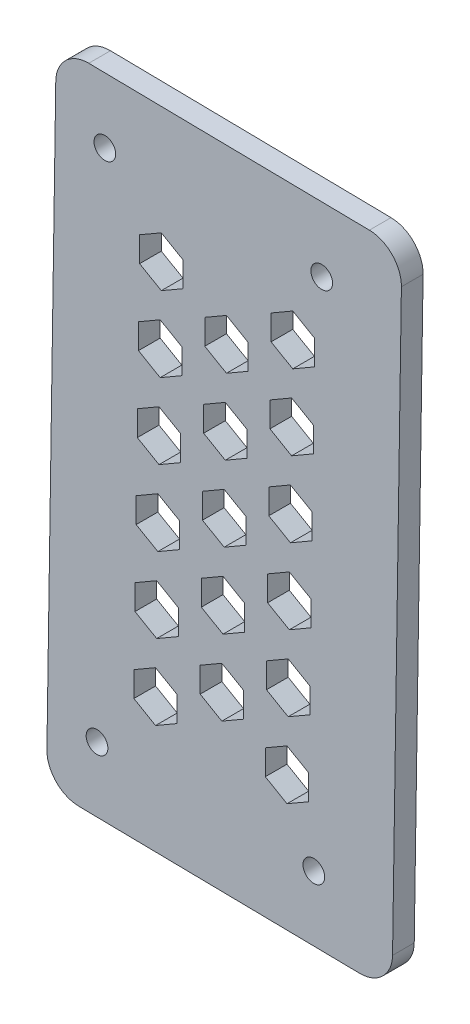
from build123d import *

# Parameters (mm, degrees)
SKETCH_1_R          = 1
EXTRUDE_1_DEPTH     = 2
FILLET_1_R          = 3
CUT_EXTRUDE_1_DEPTH = 10
OTHER_1_DEPTH       = 2


# Read off the part's stored shape, not the designer's step: 填充阵列1
with BuildPart() as part:
    # 草图1 → 凸台-拉伸1 (new body)
    with BuildSketch(Plane.XY):
        Polygon((-246.460434143, 16.421045692), (-247.367512812, -43.383226063), (-279.241752663, -42.899690556), (-278.334515728, 16.904578798), align=None)
        with Locations((-273.852745372, 10.835899523)):
            Circle(SKETCH_1_R, mode=Mode.SUBTRACT)
        with Locations((-253.855045493, 10.532585287)):
            Circle(SKETCH_1_R, mode=Mode.SUBTRACT)
        with Locations((-254.580263739, -37.273170465)):
            Circle(SKETCH_1_R, mode=Mode.SUBTRACT)
        with Locations((-274.577962013, -36.969750385)):
            Circle(SKETCH_1_R, mode=Mode.SUBTRACT)
    extrude(amount=EXTRUDE_1_DEPTH)

    # 圆角1
    fillet_1_edges = [part.edges().sort_by_distance(p)[0] for p in [
        (-246.460434143, 16.421045692, 1),
        (-247.367512812, -43.383226063, 1),
        (-279.241752663, -42.899690556, 1),
        (-278.334515728, 16.904578798, 1),
    ]]
    fillet(fillet_1_edges, radius=FILLET_1_R)

    # 草图2 → 切除-拉伸1 (cut)
    with BuildSketch(Plane.XY.offset(2)):
        Polygon((-260.851053776, -13.269658771), (-264.851053776, -13.208979355), (-264.851053776, -14.394019601), (-262.851053776, -15.54872014), (-260.851053776, -14.394019601), align=None)
        Polygon((-264.851053776, -12.084618525), (-264.851053776, -13.208979355), (-260.851053776, -13.269658771), (-260.851053776, -12.084618525), (-262.851053776, -10.929917986), align=None)
    extrude(amount=-CUT_EXTRUDE_1_DEPTH, mode=Mode.SUBTRACT)

    # 填充阵列1 outline → 填充阵列1 (cut)
    with BuildSketch(Plane.XY):
        Polygon((-258.52417318, 5.321431628), (-258.52417318, 3.012030551), (-256.52417318, 1.857330013), (-254.52417318, 3.012030551), (-254.52417318, 5.321431628), (-256.52417318, 6.476132167), align=None)
        Polygon((-271.07177439, -22.49147372), (-271.07177439, -24.800874796), (-269.07177439, -25.955575335), (-267.07177439, -24.800874796), (-267.07177439, -22.49147372), (-269.07177439, -21.336773181), align=None)
        Polygon((-258.94881311, -22.675348203), (-258.94881311, -24.98474928), (-256.94881311, -26.139449818), (-254.94881311, -24.98474928), (-254.94881311, -22.675348203), (-256.94881311, -21.520647665), align=None)
        Polygon((-264.957213759, -19.083813483), (-264.957213759, -21.393214559), (-262.957213759, -22.547915098), (-260.957213759, -21.393214559), (-260.957213759, -19.083813483), (-262.957213759, -17.929112944), align=None)
        Polygon((-270.965614407, -15.492278762), (-270.965614407, -17.801679839), (-268.965614407, -18.956380377), (-266.965614407, -17.801679839), (-266.965614407, -15.492278762), (-268.965614407, -14.337578223), align=None)
        Polygon((-265.063373741, -26.08300844), (-265.063373741, -28.392409517), (-263.063373741, -29.547110056), (-261.063373741, -28.392409517), (-261.063373741, -26.08300844), (-263.063373741, -24.928307902), align=None)
        Polygon((-259.054973093, -29.674543161), (-259.054973093, -31.983944238), (-257.054973093, -33.138644776), (-255.054973093, -31.983944238), (-255.054973093, -29.674543161), (-257.054973093, -28.519842623), align=None)
        Polygon((-271.177934372, -29.490668678), (-271.177934372, -31.800069754), (-269.177934372, -32.954770293), (-267.177934372, -31.800069754), (-267.177934372, -29.490668678), (-269.177934372, -28.335968139), align=None)
        Polygon((-270.753294442, -1.493888846), (-270.753294442, -3.803289923), (-268.753294442, -4.957990461), (-266.753294442, -3.803289923), (-266.753294442, -1.493888846), (-268.753294442, -0.339188308), align=None)
        Polygon((-258.630333163, -1.67776333), (-258.630333163, -3.987164406), (-256.630333163, -5.141864945), (-254.630333163, -3.987164406), (-254.630333163, -1.67776333), (-256.630333163, -0.523062791), align=None)
        Polygon((-264.638733811, 1.913771391), (-264.638733811, -0.395629686), (-262.638733811, -1.550330224), (-260.638733811, -0.395629686), (-260.638733811, 1.913771391), (-262.638733811, 3.068471929), align=None)
        Polygon((-270.647134459, 5.505306112), (-270.647134459, 3.195905035), (-268.647134459, 2.041204497), (-266.647134459, 3.195905035), (-266.647134459, 5.505306112), (-268.647134459, 6.66000665), align=None)
        Polygon((-258.842653128, -15.676153245), (-258.842653128, -17.985554322), (-256.842653128, -19.14025486), (-254.842653128, -17.985554322), (-254.842653128, -15.676153245), (-256.842653128, -14.521452707), align=None)
        Polygon((-270.859454424, -8.493083804), (-270.859454424, -10.802484881), (-268.859454424, -11.957185419), (-266.859454424, -10.802484881), (-266.859454424, -8.493083804), (-268.859454424, -7.338383266), align=None)
        Polygon((-258.736493145, -8.676958287), (-258.736493145, -10.986359364), (-256.736493145, -12.141059903), (-254.736493145, -10.986359364), (-254.736493145, -8.676958287), (-256.736493145, -7.522257749), align=None)
        Polygon((-264.744893794, -5.085423567), (-264.744893794, -7.394824644), (-262.744893794, -8.549525182), (-260.744893794, -7.394824644), (-260.744893794, -5.085423567), (-262.744893794, -3.930723028), align=None)
    extrude(amount=OTHER_1_DEPTH, mode=Mode.SUBTRACT)


solid = part.part
